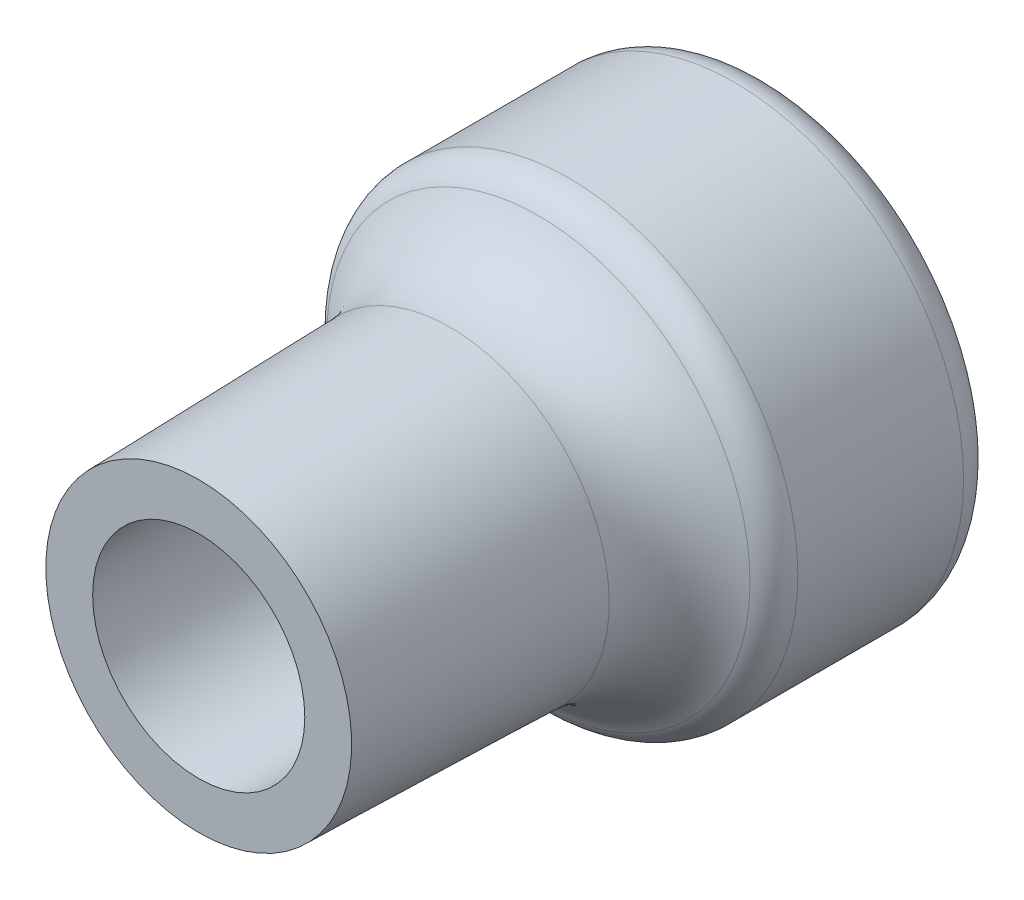
from build123d import *

# Parameters (mm, degrees)
FILLET1_R = 5.08
FILLET2_R = 2.54


with BuildPart() as part:
    # Sketch1 → Revolve1 (revolve)
    with BuildSketch(Plane(origin=(0, 0, 0), x_dir=(0, 0, -1), z_dir=(1, 0, 0)), mode=Mode.PRIVATE) as revolve1_sk:
        with BuildLine():
            Line((-18.244148936, 11.1), (0, 11.557))
            ThreePointArc((0, 11.557), (4.287180767, 13.00922662), (6.994234772, 16.637))
            Line((6.994234772, 16.637), (23.177729058, 16.637))
            Line((23.177729058, 16.637), (23.177729058, 11.557))
            Line((23.177729058, 11.557), (7.937729058, 11.557))
            Line((7.937729058, 11.557), (7.937729058, 7.5))
            Line((7.937729058, 7.5), (-18.244148936, 7.7))
            Line((-18.244148936, 7.7), (-18.244148936, 11.1))
        make_face()
    revolve(revolve1_sk.sketch.rotate(Axis((0, 0, 18.244148936), (0, 0, -1)), 180), axis=Axis((0, 0, 18.244148936), (0, 0, -1)))

    # Fillet1
    # the kernel refuses this fillet: 5.08 mm, written as the material it takes off along each edge
    with BuildSketch(Plane(origin=(0, 0, -7.937729058), x_dir=(0, -1, 0), z_dir=(1, 0, 0))) as fillet1_piece_1:
        with BuildLine():
            CenterArc((12.618097701, -4.967944411), FILLET1_R, 102.056579011, 78.38108757)
            Line((7.53824591, -5.006748745), (7.436648874, -5.007524832))
            Line((7.436648874, -5.007524832), (7.398402964, -0.000776087))
            Line((7.398402964, -0.000776087), (7.5, 0.1016))
            ThreePointArc((7.5, 0.1016), (9.5285, 0.1016), (11.535778046, 0.099358888))
            Line((11.535778046, 0.099358888), (11.557, 0))
        make_face()
    revolve(axis=Axis((0, 0, -7.937729058), (0, 0, -1)), mode=Mode.SUBTRACT)

    # Fillet2
    fillet2_edges = [part.edges().sort_by_distance(p)[0] for p in [
        (0, 16.637, -23.177729058),
        (0, 16.637, -6.994234772),
    ]]
    fillet(fillet2_edges, radius=FILLET2_R)


solid = part.part
